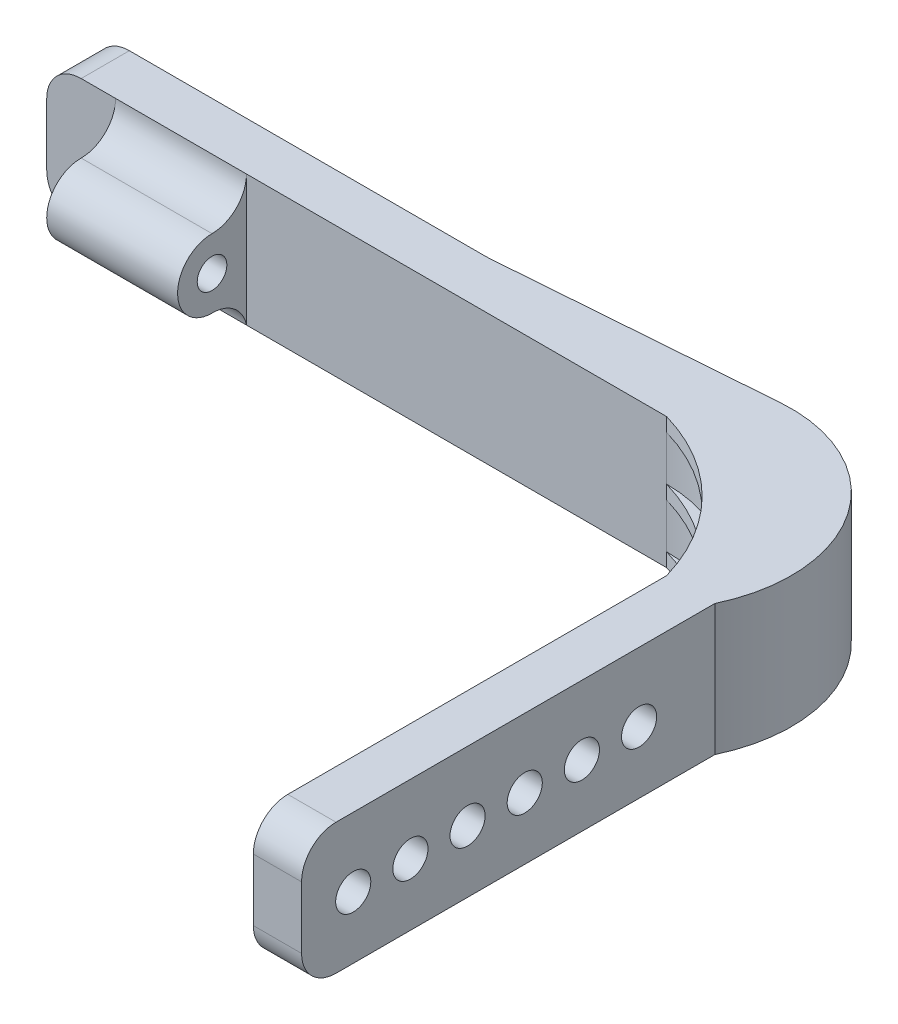
from build123d import *

# Parameters (mm, degrees)
BOSS_EXTRUDE1_DEPTH = 19
SKETCH4_R           = 2.55
CUT_EXTRUDE1_DEPTH  = 148.034009671
LPATTERN1_COUNT     = 6
LPATTERN1_PITCH     = 8.3
FILLET2_R           = 5
BOSS_EXTRUDE4_DEPTH = 19
BOSS_EXTRUDE5_DEPTH = 2
LPATTERN3_COUNT     = 3
LPATTERN3_PITCH     = 8.5
FILLET4_R           = 20
SKETCH9_R           = 2.15
BOSS_EXTRUDE6_DEPTH = 19
FILLET5_R           = 5


with BuildPart() as part:
    # Sketch1 → Boss-Extrude1 (new body)
    with BuildSketch(Plane(origin=(0, 0, 0), x_dir=(1, 0, 0), z_dir=(0, 1, 0))):
        with BuildLine():
            Line((0, 0), (90, 0))
            ThreePointArc((90, 0), (109.091883092, -7.908116908), (117, -27))
            Line((117, -27), (117, -87))
            Line((117, -87), (110, -87))
            Line((110, -87), (110, -27))
            ThreePointArc((110, -27), (104.142135624, -12.857864376), (90, -7))
            Line((90, -7), (0, -7))
            Line((0, -7), (0, 0))
        make_face()
    extrude(amount=BOSS_EXTRUDE1_DEPTH)

    # Sketch4 → Cut-Extrude1 (cut, through all)
    with BuildSketch(Plane(origin=(0, 0, 0), x_dir=(0, 0, -1), z_dir=(1, 0, 0))):
        with Locations((-79.5, 9)):
            Circle(SKETCH4_R)
    cut_extrude1 = extrude(amount=CUT_EXTRUDE1_DEPTH, mode=Mode.SUBTRACT)

    # LPattern1: Cut-Extrude1 ×6
    with Locations(*[(0, 0, -i * LPATTERN1_PITCH) for i in range(1, LPATTERN1_COUNT)]):
        add(cut_extrude1, mode=Mode.SUBTRACT)

    # Fillet2
    fillet2_edges = [part.edges().sort_by_distance(p)[0] for p in [
        (0, 0, 3.5),
        (113.5, 19, 87),
        (0, 19, 3.5),
        (113.5, 0, 87),
    ]]
    fillet(fillet2_edges, radius=FILLET2_R)

    # Sketch6 → Boss-Extrude4 (add)
    with BuildSketch(Plane(origin=(0, 0, 0), x_dir=(1, 0, 0), z_dir=(0, 1, 0))):
        with BuildLine():
            Line((57.067989457, 0), (96.460545107, 3))
            ThreePointArc((96.460545107, 3), (115.383129249, -6.075834674), (117, -27))
            ThreePointArc((117, -27), (109.091883092, -7.908116908), (90, 0))
            Line((90, 0), (57.067989457, 0))
        make_face()
    extrude(amount=BOSS_EXTRUDE4_DEPTH)

    # Sketch8 → Boss-Extrude5 (add)
    with BuildSketch(Plane(origin=(0, 0, 0), x_dir=(1, 0, 0), z_dir=(0, 1, 0))):
        with BuildLine():
            ThreePointArc((90, -7), (102.578584062, -14.421415938), (110, -27))
            ThreePointArc((110, -27), (104.142135624, -12.857864376), (90, -7))
        make_face()
    boss_extrude5 = extrude(amount=BOSS_EXTRUDE5_DEPTH)

    # LPattern3: Boss-Extrude5 ×3
    with Locations(*[(0, i * LPATTERN3_PITCH, 0) for i in range(1, LPATTERN3_COUNT)]):
        add(boss_extrude5)

    # Fillet4
    # the kernel refuses this fillet: 20 mm, written as the material it adds along each edge
    with BuildSketch(Plane(origin=(57.067989457, 0, 0), x_dir=(-1, 0, 0), z_dir=(0, 1, 0))) as fillet4_piece_1:
        with BuildLine():
            CenterArc((FILLET4_R * 0.0380232084134, -FILLET4_R), FILLET4_R, 90, 4.355040752)
            Line((-FILLET4_R * 0.0379134219382, -FILLET4_R * 0.00288735432207), (0, 0))
            Line((0, 0), (FILLET4_R * 0.0380232084134, 0))
        make_face()
    extrude(amount=19)

    # Sketch9 → Boss-Extrude6 (add)
    with BuildSketch(Plane.ZY.offset(-10)):
        with BuildLine():
            Line((7, 14), (12, 14))
            ThreePointArc((12, 14), (17, 9), (12, 4))
            Line((12, 4), (7, 4))
            Line((7, 4), (7, 14))
        make_face()
        with Locations((12, 9)):
            Circle(SKETCH9_R, mode=Mode.SUBTRACT)
    extrude(amount=-BOSS_EXTRUDE6_DEPTH)

    # Fillet5
    # the kernel refuses this fillet: 5 mm, written as the material it adds along each edge
    with BuildSketch(Plane(origin=(10, 4, 7), x_dir=(0, -1.0, 1.5831780331149625e-12), z_dir=(1, 0, 0))) as fillet5_piece_1:
        with BuildLine():
            CenterArc((5, -4.898979486), FILLET5_R, 101.536959033, 78.463040967)
            Line((0, -4.898979486), (0, 0))
            Line((0, 0), (4, 0))
        make_face()
    extrude(amount=19)
    with BuildSketch(Plane(origin=(10, 14, 7), x_dir=(0, 1, 0), z_dir=(1, 0, 0))) as fillet5_piece_2:
        with BuildLine():
            CenterArc((FILLET5_R, FILLET5_R), FILLET5_R, 180, 90)
            Line((0, FILLET5_R), (0, 0))
            Line((0, 0), (FILLET5_R, 0))
        make_face()
    extrude(amount=19)


solid = part.part
